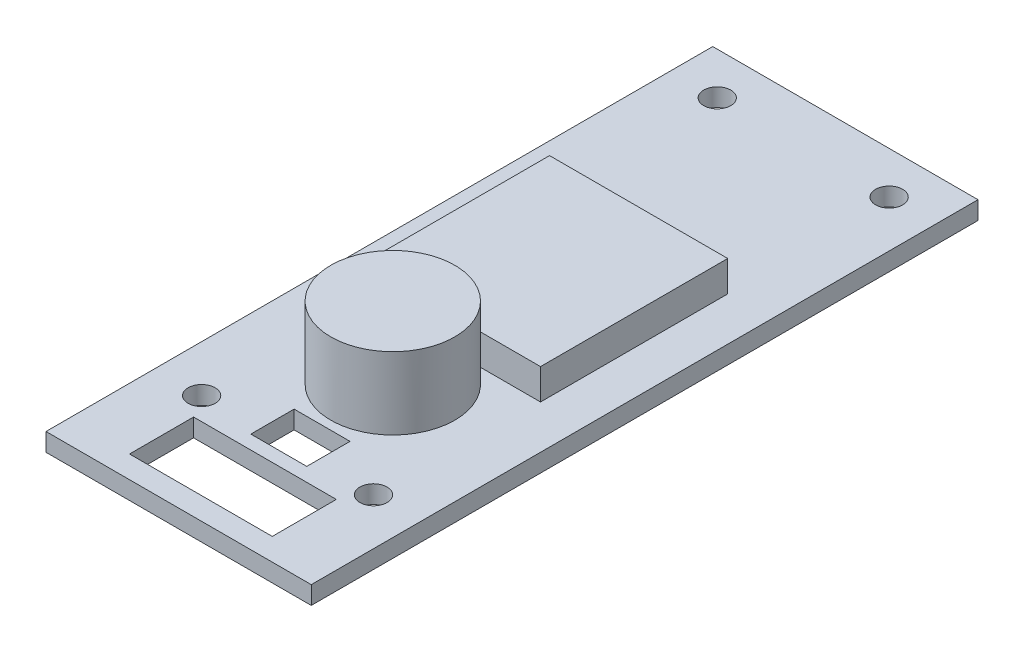
from build123d import *

# Parameters (mm, degrees)
SKETCH1_W               = 29.4
SKETCH1_H               = 73.9
SKETCH1_W_2             = 15.82
SKETCH1_H_2             = 7.1
SKETCH1_W_3             = 6.2
SKETCH1_H_3             = 4.8
BOSS_EXTRUDE1_DEPTH     = 2
SKETCH1_3_R             = 6.875
BOSS_EXTRUDE2_DEPTH     = 10
SHELL1_T                = -0.75
SKETCH1_4_W             = 19.75
SKETCH1_4_H             = 20.75
BOSS_EXTRUDE3_DEPTH     = 5.4
SKETCH2_W               = 19
SKETCH2_H               = 19
CUT_EXTRUDE1_DEPTH      = 4.4
CUT_EXTRUDE2_DEPTH      = 41.563437971
CUT_EXTRUDE2_DEPTH_BACK = 41.563437971


with BuildPart() as part:
    # Sketch1 → Boss-Extrude1 (new body)
    with BuildSketch(Plane(origin=(0, 0, 0), x_dir=(1, 0, 0), z_dir=(0, 1, 0))):
        Rectangle(SKETCH1_W, SKETCH1_H)
        with Locations((0, -30.932)):
            Rectangle(SKETCH1_W_2, SKETCH1_H_2, mode=Mode.SUBTRACT)
        with Locations((0, -23.449)):
            Rectangle(SKETCH1_W_3, SKETCH1_H_3, mode=Mode.SUBTRACT)
        with BuildLine():
            Line((-9.875, 14.036), (9.875, 14.036))
            Line((9.875, 14.036), (9.875, -6.714))
            Line((9.875, -6.714), (2.239559108, -6.714))
            ThreePointArc((2.239559108, -6.714), (0, -20.089), (-2.239559108, -6.714))
            Line((-2.239559108, -6.714), (-9.875, -6.714))
            Line((-9.875, -6.714), (-9.875, 14.036))
        make_face(mode=Mode.SUBTRACT)
    extrude(amount=BOSS_EXTRUDE1_DEPTH)



with BuildPart() as body_2:
    # Sketch1<3> → Boss-Extrude2 (new body)
    with BuildSketch(Plane(origin=(0, 0, 0), x_dir=(1, 0, 0), z_dir=(0, 1, 0))):
        with Locations(Location((0, -13.214, 0), (0, 0, 270))):
            Circle(SKETCH1_3_R)
    extrude(amount=BOSS_EXTRUDE2_DEPTH)

    # Shell1
    shell1_openings = [body_2.faces().sort_by_distance(p)[0] for p in [
        (0, 0, 13.214),
    ]]
    offset(amount=SHELL1_T, openings=shell1_openings, kind=Kind.INTERSECTION)


with BuildPart() as part_1:
    add(part.part)

    add(body_2.part)  # Boss-Extrude3 merges body 2
    # Sketch1<4> → Boss-Extrude3 (add)
    with BuildSketch(Plane(origin=(0, 0, 0), x_dir=(1, 0, 0), z_dir=(0, 1, 0))):
        with Locations((0, 3.661)):
            Rectangle(SKETCH1_4_W, SKETCH1_4_H)
    extrude(amount=BOSS_EXTRUDE3_DEPTH)

    # Sketch2 → Cut-Extrude1 (cut)
    with BuildSketch(Plane.XZ):
        with Locations((0, -3.661)):
            Rectangle(SKETCH2_W, SKETCH2_H)
    extrude(amount=-CUT_EXTRUDE1_DEPTH, mode=Mode.SUBTRACT)

    # Sketch3 → Cut-Extrude2 (cut, two sides: drawn at the far end of the back side and taken through both)
    with BuildSketch(Plane(origin=(0, 2, 0), x_dir=(1, 0, 0), z_dir=(0, 1, 0)).offset(-CUT_EXTRUDE2_DEPTH_BACK)):
        with BuildLine():
            Line((-9.525, 30.775), (-9.525, 32.275))
            Line((-9.525, 32.275), (-8.025, 32.275))
            ThreePointArc((-8.025, 32.275), (-10.585660172, 33.335660172), (-9.525, 30.775))
        make_face()
        with BuildLine():
            Line((-8.025, 32.275), (-9.525, 32.275))
            Line((-9.525, 32.275), (-9.525, 30.775))
            ThreePointArc((-9.525, 30.775), (-8.464339828, 31.214339828), (-8.025, 32.275))
        make_face()
        with BuildLine():
            ThreePointArc((11.025, 32.275), (9.525, 33.775), (8.025, 32.275))
            Line((8.025, 32.275), (9.525, 32.275))
            Line((9.525, 32.275), (9.525, 30.775))
            ThreePointArc((9.525, 30.775), (10.585660172, 31.214339828), (11.025, 32.275))
        make_face()
        with BuildLine():
            Line((9.525, 32.275), (8.025, 32.275))
            ThreePointArc((8.025, 32.275), (8.464339828, 31.214339828), (9.525, 30.775))
            Line((9.525, 30.775), (9.525, 32.275))
        make_face()
        with BuildLine():
            ThreePointArc((11.025, -24.875), (10.585660172, -23.814339828), (9.525, -23.375))
            Line((9.525, -23.375), (9.525, -24.875))
            Line((9.525, -24.875), (8.025, -24.875))
            ThreePointArc((8.025, -24.875), (9.525, -26.375), (11.025, -24.875))
        make_face()
        with BuildLine():
            Line((9.525, -24.875), (9.525, -23.375))
            ThreePointArc((9.525, -23.375), (8.464339828, -23.814339828), (8.025, -24.875))
            Line((8.025, -24.875), (9.525, -24.875))
        make_face()
        with BuildLine():
            ThreePointArc((-8.025, -24.875), (-8.464339828, -23.814339828), (-9.525, -23.375))
            Line((-9.525, -23.375), (-9.525, -24.875))
            Line((-9.525, -24.875), (-8.025, -24.875))
        make_face()
        with BuildLine():
            Line((-9.525, -24.875), (-9.525, -23.375))
            ThreePointArc((-9.525, -23.375), (-10.585660172, -25.935660172), (-8.025, -24.875))
            Line((-8.025, -24.875), (-9.525, -24.875))
        make_face()
    extrude(amount=CUT_EXTRUDE2_DEPTH + CUT_EXTRUDE2_DEPTH_BACK, mode=Mode.SUBTRACT)


solid = part_1.part
